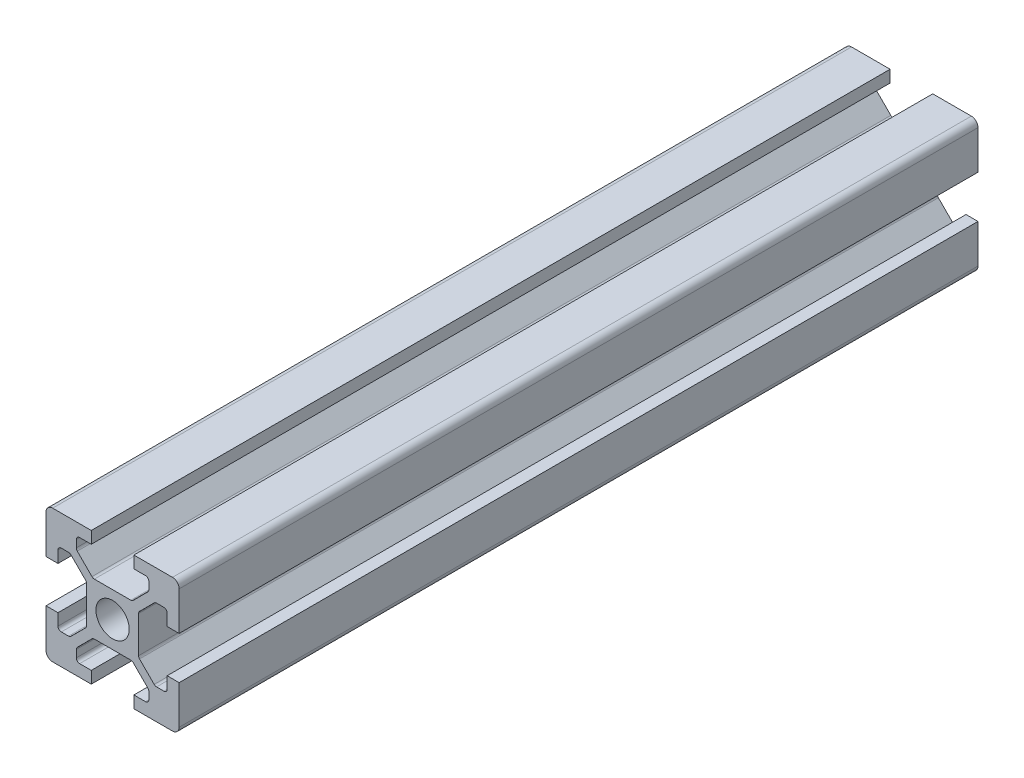
from build123d import *

# Parameters (mm, degrees)
SKETCH1_R           = 2.5
BOSS_EXTRUDE1_DEPTH = 120
FILLET1_R           = 1
FILLET2_R           = 0.5
FILLET3_R           = 0.5
FILLET4_R           = 0.5
FILLET5_R           = 0.5


with BuildPart() as part:
    # Sketch1 → Boss-Extrude1 (new body)
    with BuildSketch(Plane.XY):
        Polygon((0, 6.8), (0, 0), (6.8, 0), (6.8, 1.8), (4.55, 1.8), (4.55, 3.6), (7.05, 6.1), (12.95, 6.1), (15.45, 3.6), (15.45, 1.8), (13.2, 1.8), (13.2, 0), (20, 0), (20, 6.8), (18.2, 6.8), (18.2, 4.55), (16.4, 4.55), (13.9, 7.05), (13.9, 12.95), (16.4, 15.45), (18.2, 15.45), (18.2, 13.2), (20, 13.2), (20, 20), (13.2, 20), (13.2, 18.2), (15.45, 18.2), (15.45, 16.4), (12.95, 13.9), (7.05, 13.9), (4.55, 16.4), (4.55, 18.2), (6.8, 18.2), (6.8, 20), (0, 20), (0, 13.2), (1.8, 13.2), (1.8, 15.45), (3.6, 15.45), (6.1, 12.95), (6.1, 7.05), (3.6, 4.55), (1.8, 4.55), (1.8, 6.8), align=None)
        with Locations((10, 10)):
            Circle(SKETCH1_R, mode=Mode.SUBTRACT)
    extrude(amount=BOSS_EXTRUDE1_DEPTH)

    # Fillet1
    fillet1_edges = [part.edges().sort_by_distance(p)[0] for p in [
        (20, 20, 60),
        (20, 0, 60),
        (0, 0, 60),
        (0, 20, 60),
    ]]
    fillet(fillet1_edges, radius=FILLET1_R)

    # Fillet2
    fillet2_edges = [part.edges().sort_by_distance(p)[0] for p in [
        (4.55, 18.2, 60),
        (4.55, 16.4, 60),
        (7.05, 13.9, 60),
        (15.45, 18.2, 60),
        (15.45, 16.4, 60),
        (12.95, 13.9, 60),
    ]]
    fillet(fillet2_edges, radius=FILLET2_R)

    # Fillet3
    fillet3_edges = [part.edges().sort_by_distance(p)[0] for p in [
        (18.2, 15.45, 60),
        (16.4, 15.45, 60),
        (13.9, 12.95, 60),
        (18.2, 4.55, 60),
        (13.9, 7.05, 60),
        (16.4, 4.55, 60),
    ]]
    fillet(fillet3_edges, radius=FILLET3_R)

    # Fillet4
    fillet4_edges = [part.edges().sort_by_distance(p)[0] for p in [
        (1.8, 15.45, 60),
        (3.6, 15.45, 60),
        (6.1, 12.95, 60),
        (3.6, 4.55, 60),
        (1.8, 4.55, 60),
        (6.1, 7.05, 60),
    ]]
    fillet(fillet4_edges, radius=FILLET4_R)

    # Fillet5
    fillet5_edges = [part.edges().sort_by_distance(p)[0] for p in [
        (7.05, 6.1, 60),
        (4.55, 3.6, 60),
        (4.55, 1.8, 60),
        (15.45, 1.8, 60),
        (15.45, 3.6, 60),
        (12.95, 6.1, 60),
    ]]
    fillet(fillet5_edges, radius=FILLET5_R)


solid = part.part
